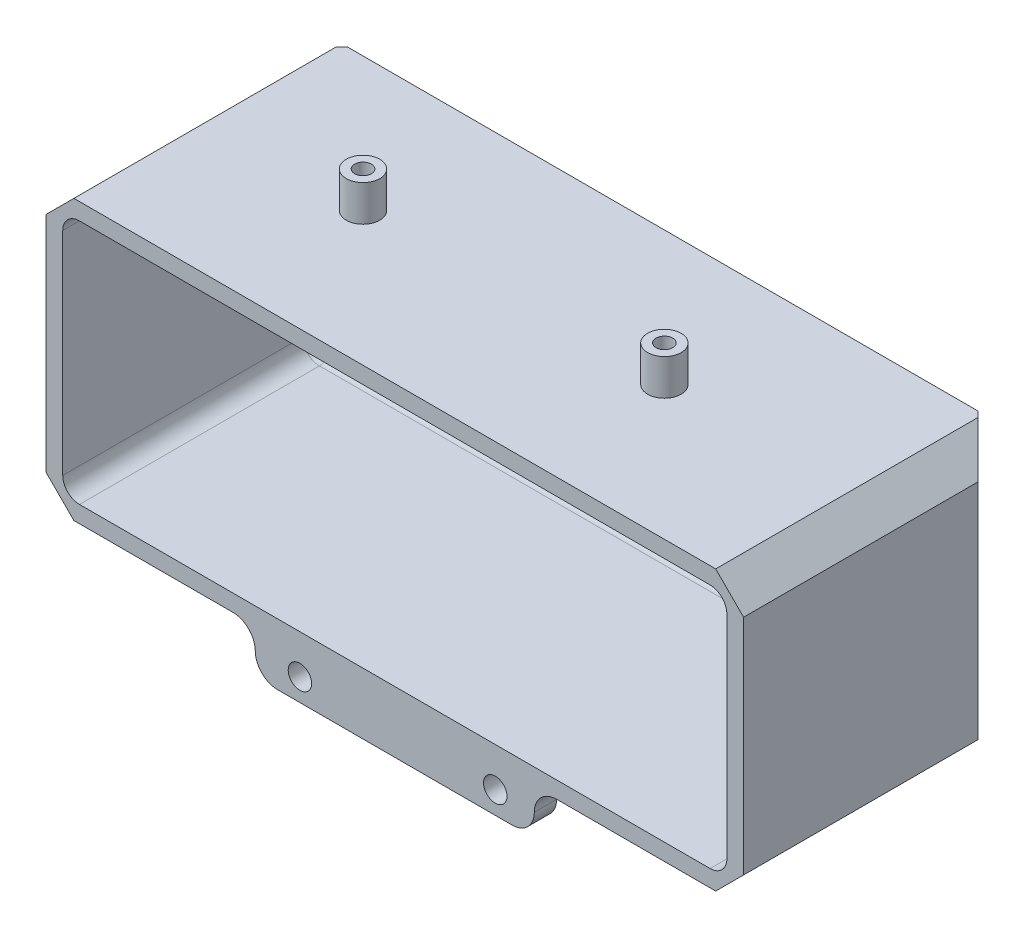
from build123d import *

# Parameters (mm, degrees)
SKETCH_1_W             = 125
SKETCH_1_H             = 50
EXTRUDE_1_DEPTH        = 3
SKETCH_2_W             = 125
SKETCH_2_H             = 50
SKETCH_2_W_2           = 119
SKETCH_2_H_2           = 44
EXTRUDE_2_DEPTH        = 45
EXTRUDE_START          = 33
EXTRUDE_3_DEPTH        = 12
SKETCH_6_W             = 50
SKETCH_6_H             = 8
SKETCH_6_R             = 2.1
EXTRUDE_7_DEPTH        = 4
FILLET_START           = 43
FILLET_10_DEPTH        = 5
FILLET_START_2         = 44
FILLET_10_2_DEPTH      = 4
CHAMFER_2_SIZE         = 6
FILLET_12_R            = 2
CHAMFER_3_SIZE         = 5
SKETCH_7_R             = 1.35
CUT_EXTRUDE_1_DEPTH    = 86.435648297
PATTERN_LINEAR_2_COUNT = 2
PATTERN_LINEAR_2_PITCH = 39
FILLET_13_R            = 2
SKETCH_8_W             = 12
SKETCH_8_H             = 8
CUT_EXTRUDE_2_DEPTH    = 86.435648297
FILLET_14_R            = 3
SKETCH_9_W             = 61.451933819
SKETCH_9_H             = 10.261376853
CUT_EXTRUDE_3_DEPTH    = 70
SKETCH_10_R            = 3
SKETCH_10_R_2          = 1.5
EXTRUDE_8_DEPTH        = 6.47


with BuildPart() as part:
    # 草图1 → 凸台-拉伸1 (new body)
    with BuildSketch(Plane.XY):
        Rectangle(SKETCH_1_W, SKETCH_1_H)
    extrude(amount=EXTRUDE_1_DEPTH)

    # 草图2 → 凸台-拉伸2 (add)
    with BuildSketch(Plane.XY.offset(3)):
        Rectangle(SKETCH_2_W, SKETCH_2_H)
        Rectangle(SKETCH_2_W_2, SKETCH_2_H_2, mode=Mode.SUBTRACT)
    extrude(amount=EXTRUDE_2_DEPTH)

    # 草图3 → 凸台-拉伸3 (add)
    with BuildSketch(Plane(origin=(0, 0, 0), x_dir=(0, 0, -1), z_dir=(1, 0, 0)).offset(EXTRUDE_START)):
        Polygon((0, 25), (-48, 33), (-48, 25), align=None)
        Polygon((-48, -25), (0, -25), (-48, -33), align=None)
    extrude_3 = extrude(amount=EXTRUDE_3_DEPTH)

    # 草图6 → 凸台-拉伸7 (add)
    # profile 1 of 2: a face of its own
    with BuildSketch(Plane.XY.offset(48)):
        with Locations((0, 29)):
            Rectangle(SKETCH_6_W, SKETCH_6_H)
        with Locations((-17, 29)):
            Circle(SKETCH_6_R, mode=Mode.SUBTRACT)
        with Locations((18, 29)):
            Circle(SKETCH_6_R, mode=Mode.SUBTRACT)
    # profile 2 of 2: a face of its own
    with BuildSketch(Plane.XY.offset(48)):
        with Locations((0, -29)):
            Rectangle(SKETCH_6_W, SKETCH_6_H)
        with Locations(Location((-17, -29, 0), (0, 0, 180))):
            Circle(SKETCH_6_R, mode=Mode.SUBTRACT)
        with Locations((18, -29)):
            Circle(SKETCH_6_R, mode=Mode.SUBTRACT)
    extrude(amount=-EXTRUDE_7_DEPTH)

    # 圆角10: read off the stored shape, not the designer's step
    # 圆角10 outline → 圆角10 (cut)
    with BuildSketch(Plane.XY.offset(FILLET_START)):
        with BuildLine():
            ThreePointArc((25, -29), (23.828427125, -31.828427125), (21, -33))
            Line((21, -33), (25, -33))
            Line((25, -33), (25, -29))
        make_face()
        with BuildLine():
            Line((-25, -33), (-21, -33))
            ThreePointArc((-21, -33), (-23.828427125, -31.828427125), (-25, -29))
            Line((-25, -29), (-25, -33))
        make_face()
        with BuildLine():
            ThreePointArc((-25, 29), (-23.828427125, 31.828427125), (-21, 33))
            Line((-21, 33), (-25, 33))
            Line((-25, 33), (-25, 29))
        make_face()
        with BuildLine():
            Line((25, 33), (21, 33))
            ThreePointArc((21, 33), (23.828427125, 31.828427125), (25, 29))
            Line((25, 29), (25, 33))
        make_face()
    extrude(amount=FILLET_10_DEPTH, mode=Mode.SUBTRACT)

    # Fillet 10 2 outline → Fillet 10 2 (add)
    with BuildSketch(Plane.XY.offset(FILLET_START_2)):
        with BuildLine():
            Line((25, -25), (25, -29))
            ThreePointArc((25, -29), (26.171572875, -26.171572875), (29, -25))
            Line((29, -25), (25, -25))
        make_face()
        with BuildLine():
            ThreePointArc((-29, -25), (-26.171572875, -26.171572875), (-25, -29))
            Line((-25, -29), (-25, -25))
            Line((-25, -25), (-29, -25))
        make_face()
        with BuildLine():
            Line((-25, 25), (-25, 29))
            ThreePointArc((-25, 29), (-26.171572875, 26.171572875), (-29, 25))
            Line((-29, 25), (-25, 25))
        make_face()
        with BuildLine():
            ThreePointArc((29, 25), (26.171572875, 26.171572875), (25, 29))
            Line((25, 29), (25, 25))
            Line((25, 25), (29, 25))
        make_face()
    extrude(amount=FILLET_10_2_DEPTH)

    # 倒角2
    chamfer_2_edges = [part.edges().sort_by_distance(p)[0] for p in [
        (-62.5, 0, 0),
        (62.5, 0, 0),
    ]]
    chamfer(chamfer_2_edges, length=CHAMFER_2_SIZE)

    # 圆角12
    fillet_12_edges = [part.edges().sort_by_distance(p)[0] for p in [
        (0, -22, 3),
        (59.5, 0, 3),
        (0, 22, 3),
        (-59.5, 0, 3),
    ]]
    fillet(fillet_12_edges, radius=FILLET_12_R)

    # 倒角3
    chamfer_3_edges = [part.edges().sort_by_distance(p)[0] for p in [
        (62.5, -25, 27),
        (-62.5, -25, 27),
        (-62.5, 25, 27),
        (62.5, 25, 27),
    ]]
    chamfer(chamfer_3_edges, length=CHAMFER_3_SIZE)

    # 草图7 → 切除-拉伸1 (cut, through all)
    with BuildSketch(Plane(origin=(0, 0, 0), x_dir=(-1, 0, 0), z_dir=(0, 0, -1))):
        with Locations((-12, 0)):
            Circle(SKETCH_7_R)
        with Locations((12, 0)):
            Circle(SKETCH_7_R)
    extrude(amount=-CUT_EXTRUDE_1_DEPTH, mode=Mode.SUBTRACT)

    # 阵列(线性)2: 凸台-拉伸3 ×2
    with Locations(*[(-i * PATTERN_LINEAR_2_PITCH, 0, 0) for i in range(1, PATTERN_LINEAR_2_COUNT)]):
        add(extrude_3)

    # 圆角13
    fillet_13_edges = [part.edges().sort_by_distance(p)[0] for p in [
        (-6, 28.666666667, 22),
        (6, 28.666666667, 22),
        (-6, -28.666666667, 22),
        (6, -28.666666667, 22),
    ]]
    fillet(fillet_13_edges, radius=FILLET_13_R)

    # 草图8 → 切除-拉伸2 (cut, through all)
    with BuildSketch(Plane.XY.offset(48)):
        with Locations((39, 29)):
            Rectangle(SKETCH_8_W, SKETCH_8_H)
        with Locations((39, -29)):
            Rectangle(SKETCH_8_W, SKETCH_8_H)
    extrude(amount=-CUT_EXTRUDE_2_DEPTH, mode=Mode.SUBTRACT)

    # 圆角14
    # the kernel refuses this fillet: 3 mm, written as the material it adds along each edge
    with BuildSketch(Plane(origin=(56.5, 19, 3), x_dir=(0, 1, 0), z_dir=(-1, 0, 0))) as fillet_14_piece_1:
        with BuildLine():
            CenterArc((1, -2), 2, 0, 90)
            Line((3, -2), (3, 0))
            Line((3, 0), (1, 0))
        make_face()
    revolve(axis=Axis((56.5, 19, 3), (0, 0, -1)), revolution_arc=90)
    with BuildSketch(Plane(origin=(56.5, -19, 3), x_dir=(1, 0, 0), z_dir=(0, 1, 0))) as fillet_14_piece_2:
        with BuildLine():
            CenterArc((1, -2), 2, 0, 90)
            Line((3, -2), (3, 0))
            Line((3, 0), (1, 0))
        make_face()
    revolve(axis=Axis((56.5, -19, 3), (0, 0, -1)), revolution_arc=90)
    with BuildSketch(Plane(origin=(-56.5, 19, 3), x_dir=(-1, 0, 0), z_dir=(0, -1, 0))) as fillet_14_piece_3:
        with BuildLine():
            CenterArc((1, -2), 2, 0, 90)
            Line((3, -2), (3, 0))
            Line((3, 0), (1, 0))
        make_face()
    revolve(axis=Axis((-56.5, 19, 3), (0, 0, -1)), revolution_arc=90)
    with BuildSketch(Plane(origin=(-56.5, -19, 3), x_dir=(0, -1, 0), z_dir=(1, 0, 0))) as fillet_14_piece_4:
        with BuildLine():
            CenterArc((1, -2), 2, 0, 90)
            Line((3, -2), (3, 0))
            Line((3, 0), (1, 0))
        make_face()
    revolve(axis=Axis((-56.5, -19, 3), (0, 0, -1)), revolution_arc=90)
    with BuildSketch(Plane(origin=(59.5, -22, 3), x_dir=(0, 1, 0), z_dir=(0, 0, 1))) as fillet_14_piece_5:
        with BuildLine():
            CenterArc((FILLET_14_R, FILLET_14_R), FILLET_14_R, 180, 90)
            Line((0, FILLET_14_R), (0, 0))
            Line((0, 0), (FILLET_14_R, 0))
        make_face()
    extrude(amount=45)
    with BuildSketch(Plane(origin=(59.5, 22, 3), x_dir=(0, -1, 0), z_dir=(0, 0, 1)), Plane(origin=(-59.5, 22, 3), x_dir=(1, 0, 0), z_dir=(0, 0, 1)), Plane(origin=(-59.5, -22, 3), x_dir=(0, 1, 0), z_dir=(0, 0, 1))) as fillet_14_piece_6:
        with BuildLine():
            CenterArc((FILLET_14_R, -FILLET_14_R), FILLET_14_R, 90, 90)
            Line((0, -FILLET_14_R), (0, 0))
            Line((0, 0), (FILLET_14_R, 0))
        make_face()
    extrude(amount=45)

    # 草图9 → 切除-拉伸3 (cut)
    with BuildSketch(Plane(origin=(0, 0, 0), x_dir=(-1, 0, 0), z_dir=(0, 0, -1))):
        with Locations((1.72596691, 30.130688427)):
            Rectangle(SKETCH_9_W, SKETCH_9_H)
    extrude(amount=-CUT_EXTRUDE_3_DEPTH, mode=Mode.SUBTRACT)

    # 草图10 → 凸台-拉伸8 (add)
    # profile 1 of 2: a face of its own
    with BuildSketch(Plane(origin=(0, 25, 0), x_dir=(1, 0, 0), z_dir=(0, 1, 0))):
        with Locations(Location((-29.695093854, -24, 0), (0, 0, 90))):
            Circle(SKETCH_10_R)
        with Locations(Location((-29.695093854, -24, 0), (0, 0, 270))):
            Circle(SKETCH_10_R_2, mode=Mode.SUBTRACT)
    # profile 2 of 2: a face of its own
    with BuildSketch(Plane(origin=(0, 25, 0), x_dir=(1, 0, 0), z_dir=(0, 1, 0))):
        with Locations(Location((24.304906146, -24, 0), (0, 0, 90))):
            Circle(SKETCH_10_R)
        with Locations(Location((24.304906146, -24, 0), (0, 0, 270))):
            Circle(SKETCH_10_R_2, mode=Mode.SUBTRACT)
    extrude(amount=EXTRUDE_8_DEPTH)


solid = part.part
